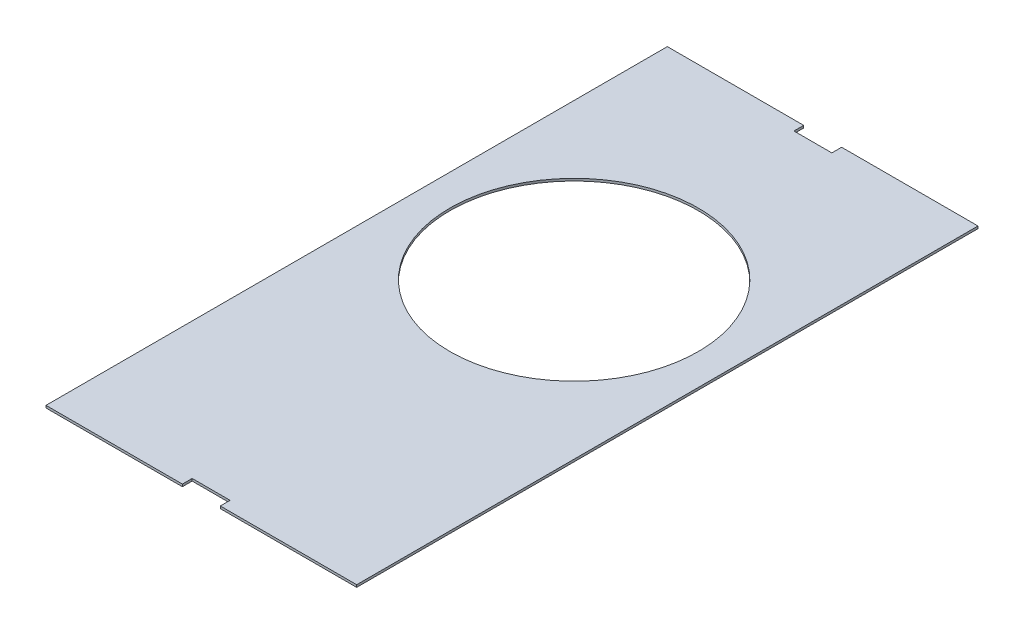
from build123d import *

# Parameters (mm, degrees)
BASESKETCH_W        = 508
BASESKETCH_H        = 1016
BOSS_EXTRUDE1_DEPTH = 3.81
TABCUTSKETCH_W      = 62
TABCUTSKETCH_H      = 16
CUT_EXTRUDE1_DEPTH  = 568.97404527
SKETCH6_R           = 203.2
CUT_EXTRUDE10_DEPTH = 3.81


with BuildPart() as part:
    # BaseSketch → Boss-Extrude1 (new body)
    with BuildSketch(Plane(origin=(0, 0, 0), x_dir=(1, 0, 0), z_dir=(0, 1, 0))):
        Rectangle(BASESKETCH_W, BASESKETCH_H)
    extrude(amount=BOSS_EXTRUDE1_DEPTH)

    # TabCutSketch → Cut-Extrude1 (cut, through all)
    with BuildSketch(Plane(origin=(0, 3.81, 0), x_dir=(1, 0, 0), z_dir=(0, 1, 0))):
        with Locations((0, -500)):
            Rectangle(TABCUTSKETCH_W, TABCUTSKETCH_H)
        with Locations((0, 500)):
            Rectangle(TABCUTSKETCH_W, TABCUTSKETCH_H)
    extrude(amount=-CUT_EXTRUDE1_DEPTH, mode=Mode.SUBTRACT)

    # Sketch6 → Cut-Extrude10 (cut)
    with BuildSketch(Plane(origin=(0, 3.81, 0), x_dir=(1, 0, 0), z_dir=(0, 1, 0))):
        with Locations((0, 101.6)):
            Circle(SKETCH6_R)
    extrude(amount=-CUT_EXTRUDE10_DEPTH, mode=Mode.SUBTRACT)


solid = part.part
